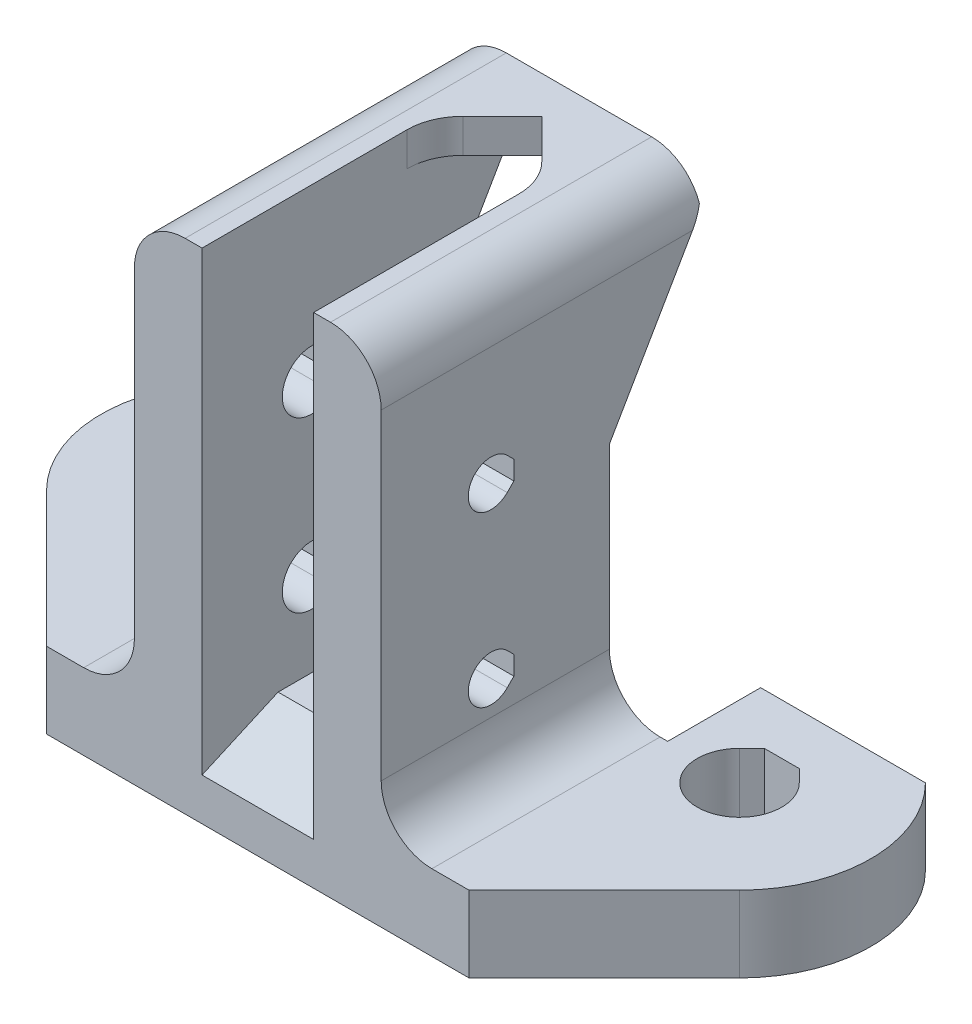
from build123d import *
from OCP.BRepFilletAPI import BRepFilletAPI_MakeChamfer

# Parameters (mm, degrees)
BOSS_EXTRUDE1_DEPTH = 4.5
BOSS_EXTRUDE2_DEPTH = 19
SKETCH4_W           = 6.6
SKETCH4_H           = 4.8
BOSS_EXTRUDE4_DEPTH = 2
SKETCH5_W           = 6.6
SKETCH5_H           = 2
CUT_EXTRUDE1_DEPTH  = 4.5
CUT_EXTRUDE2_REACH  = 45.186
CUT_EXTRUDE4_REACH  = 45.186
SKETCH9_W           = 6.6
SKETCH9_H           = 2
CUT_EXTRUDE5_DEPTH  = 16.8
FILLET3_R           = 3
SKETCH12_W          = 21.495
SKETCH12_H          = 5.5
CUT_EXTRUDE8_DEPTH  = 18
FILLET7_R           = 3
CHAMFER2_SIZE2      = 2
CHAMFER2_SIZE       = 4.5
CHAMFER3_SIZE       = 3.3
FILLET8_R           = 3.3
CHAMFER4_SIZE       = 9.5
CHAMFER4_SIZE_2     = 5.5


with BuildPart() as part:
    # Sketch1 → Boss-Extrude1 (new body)
    with BuildSketch(Plane(origin=(0, 0, 0), x_dir=(1, 0, 0), z_dir=(0, 1, 0))):
        with BuildLine():
            Line((-20.4975, -1.5), (-12.4975, -9.5))
            Line((-12.4975, -9.5), (12.4975, -9.5))
            Line((12.4975, -9.5), (20.4975, -1.5))
            ThreePointArc((20.4975, -1.5), (22.775674593, 4), (20.4975, 9.5))
            Line((20.4975, 9.5), (-20.4975, 9.5))
            ThreePointArc((-20.4975, 9.5), (-22.775674593, 4), (-20.4975, -1.5))
        make_face()
        with BuildLine():
            Line((-16.765266953, 5.767766953), (-16.033033906, 6.5))
            Line((-16.033033906, 6.5), (-13.961966094, 6.5))
            Line((-13.961966094, 6.5), (-13.229733047, 5.767766953))
            ThreePointArc((-13.229733047, 5.767766953), (-13.229733045, 2.232233049), (-16.765266949, 2.232233043))
            ThreePointArc((-16.765266949, 2.232233043), (-17.30719883, 3.043291416), (-17.4975, 4))
            ThreePointArc((-17.4975, 4), (-17.307198831, 4.956708581), (-16.765266953, 5.767766953))
        make_face(mode=Mode.SUBTRACT)
        with BuildLine():
            Line((13.229733047, 5.767766953), (13.961966094, 6.5))
            Line((13.961966094, 6.5), (16.033033906, 6.5))
            Line((16.033033906, 6.5), (16.765266953, 5.767766953))
            ThreePointArc((16.765266953, 5.767766953), (16.765266949, 2.232233043), (13.229733038, 2.232233056))
            ThreePointArc((13.229733038, 2.232233056), (12.4975, 4.000000006), (13.229733047, 5.767766953))
        make_face(mode=Mode.SUBTRACT)
    extrude(amount=BOSS_EXTRUDE1_DEPTH)

    # Sketch2 → Boss-Extrude2 (add, through all)
    with BuildSketch(Plane(origin=(0, 0, -9.5), x_dir=(-1, 0, 0), z_dir=(0, 0, -1))):
        Polygon((-7.3, 4.5), (-3.3, 4.5), (-3.3, 27.5), (3.3, 27.5), (3.3, 4.5), (7.3, 4.5), (7.3, 29.5), (-7.3, 29.5), align=None)
    extrude(amount=-BOSS_EXTRUDE2_DEPTH)

    # Sketch4 → Boss-Extrude4 (add)
    with BuildSketch(Plane(origin=(0, 4.5, 0), x_dir=(1, 0, 0), z_dir=(0, 1, 0))):
        with Locations((0, 7.1)):
            Rectangle(SKETCH4_W, SKETCH4_H)
    extrude(amount=BOSS_EXTRUDE4_DEPTH)

    # Sketch5 → Cut-Extrude1 (cut)
    with BuildSketch(Plane.XY.offset(9.5)):
        with Locations((0, 3.5)):
            Rectangle(SKETCH5_W, SKETCH5_H)
    extrude(amount=-CUT_EXTRUDE1_DEPTH, mode=Mode.SUBTRACT)

    # Sketch6 → Cut-Extrude2 (cut, up to next)
    with BuildSketch(Plane(origin=(7.3, 0, 0), x_dir=(0, 0, -1), z_dir=(1, 0, 0)), mode=Mode.PRIVATE) as cut_extrude2_sk1:
        with BuildLine():
            Line((-1.65, 20.059188309), (-2.045405845, 20.454594155))
            ThreePointArc((-2.045405845, 20.454594155), (-4.35, 19.5), (-2.045405845, 18.545405845))
            Line((-2.045405845, 18.545405845), (-1.65, 18.940811691))
            Line((-1.65, 18.940811691), (-1.65, 20.059188309))
        make_face()
    cut_extrude2_tool1 = extrude(cut_extrude2_sk1.sketch, amount=-CUT_EXTRUDE2_REACH, mode=Mode.PRIVATE) & part.part
    # Sketch6 → Cut-Extrude2 (cut, up to next)
    with BuildSketch(Plane(origin=(7.3, 0, 0), x_dir=(0, 0, -1), z_dir=(1, 0, 0)), mode=Mode.PRIVATE) as cut_extrude2_sk2:
        with BuildLine():
            Line((-1.65, 10.059188309), (-2.045405845, 10.454594155))
            ThreePointArc((-2.045405845, 10.454594155), (-4.35, 9.5), (-2.045405845, 8.545405845))
            Line((-2.045405845, 8.545405845), (-1.65, 8.940811691))
            Line((-1.65, 8.940811691), (-1.65, 10.059188309))
        make_face()
    cut_extrude2_tool2 = extrude(cut_extrude2_sk2.sketch, amount=-CUT_EXTRUDE2_REACH, mode=Mode.PRIVATE) & part.part
    add(cut_extrude2_tool1.solids().sort_by_distance((7.3, 19.5, 2.982857))[0], mode=Mode.SUBTRACT)
    add(cut_extrude2_tool2.solids().sort_by_distance((7.3, 9.5, 2.982857))[0], mode=Mode.SUBTRACT)

    # Sketch8 → Cut-Extrude4 (cut, up to next)
    with BuildSketch(Plane.ZY.offset(7.3), mode=Mode.PRIVATE) as cut_extrude4_sk1:
        with BuildLine():
            Line((1.25, 10.224873734), (1.25, 8.775126266))
            Line((1.25, 8.775126266), (1.762563133, 8.262563133))
            ThreePointArc((1.762563133, 8.262563133), (4.75, 9.5), (1.762563133, 10.737436867))
            Line((1.762563133, 10.737436867), (1.25, 10.224873734))
        make_face()
    cut_extrude4_tool1 = extrude(cut_extrude4_sk1.sketch, amount=-CUT_EXTRUDE4_REACH, mode=Mode.PRIVATE) & part.part
    # Sketch8 → Cut-Extrude4 (cut, up to next)
    with BuildSketch(Plane.ZY.offset(7.3), mode=Mode.PRIVATE) as cut_extrude4_sk2:
        with BuildLine():
            Line((1.25, 20.224873734), (1.25, 18.775126266))
            Line((1.25, 18.775126266), (1.762563133, 18.262563133))
            ThreePointArc((1.762563133, 18.262563133), (4.75, 19.5), (1.762563133, 20.737436867))
            Line((1.762563133, 20.737436867), (1.25, 20.224873734))
        make_face()
    cut_extrude4_tool2 = extrude(cut_extrude4_sk2.sketch, amount=-CUT_EXTRUDE4_REACH, mode=Mode.PRIVATE) & part.part
    add(cut_extrude4_tool1.solids().sort_by_distance((-7.3, 9.5, 2.977778))[0], mode=Mode.SUBTRACT)
    add(cut_extrude4_tool2.solids().sort_by_distance((-7.3, 19.5, 2.977778))[0], mode=Mode.SUBTRACT)

    # Sketch9 → Cut-Extrude5 (cut)
    with BuildSketch(Plane.XY.offset(9.5)):
        with Locations((0, 28.5)):
            Rectangle(SKETCH9_W, SKETCH9_H)
    extrude(amount=-CUT_EXTRUDE5_DEPTH, mode=Mode.SUBTRACT)

    # Fillet3
    fillet3_edges = [part.edges().sort_by_distance(p)[0] for p in [
        (-7.3, 4.5, 0),
        (7.3, 4.5, 0),
    ]]
    fillet(fillet3_edges, radius=FILLET3_R)

    # Sketch12 → Cut-Extrude8 (cut)
    with BuildSketch(Plane.XZ):
        with Locations((0, -6.75)):
            Rectangle(SKETCH12_W, SKETCH12_H)
    extrude(amount=-CUT_EXTRUDE8_DEPTH, mode=Mode.SUBTRACT)

    # Fillet7
    fillet7_edges = [part.edges().sort_by_distance(p)[0] for p in [
        (-7.3, 29.5, 0),
        (7.3, 29.5, 0),
    ]]
    fillet(fillet7_edges, radius=FILLET7_R)

    # Chamfer2
    chamfer2_edges = [part.edges().sort_by_distance(p)[0] for p in [
        (0, 2.5, 5),
    ]]
    chamfer2_side = [part.faces().sort_by_distance(p)[0] for p in [
        (0, 2.5, 5.04),
    ]]
    chamfer(chamfer2_edges, length=CHAMFER2_SIZE - 0.0001, length2=CHAMFER2_SIZE2 - 0.0001, reference=chamfer2_side[0])  # a hair under: the kernel refuses the full size

    # Chamfer3
    chamfer3_edges = [part.edges().sort_by_distance(p)[0] for p in [
        (-3.3, 28.5, -7.3),
        (3.3, 28.5, -7.3),
    ]]
    chamfer(chamfer3_edges, length=CHAMFER3_SIZE - 0.0001)  # a hair under: the kernel refuses the full size

    # Fillet8
    fillet8_edges = [part.edges().sort_by_distance(p)[0] for p in [
        (-3.3, 28.5, -4.0001),
        (3.3, 28.5, -4.0001),
    ]]
    fillet(fillet8_edges, radius=FILLET8_R)

    # Chamfer4
    chamfer4_edges_1 = [part.edges().sort_by_distance(p)[0] for p in [
        (-5.3, 18, -9.5),
    ]]
    chamfer4_side_1 = [part.faces().sort_by_distance(p)[0] for p in [
        (-5.3, 18.11, -9.5),
    ]]
    chamfer4_edges_2 = [part.edges().sort_by_distance(p)[0] for p in [
        (5.3, 18, -9.5),
    ]]
    chamfer4_side_2 = [part.faces().sort_by_distance(p)[0] for p in [
        (5.3, 18, -9.39),
    ]]
    chamfer4 = BRepFilletAPI_MakeChamfer(part.part.solid().wrapped)
    for e in chamfer4_edges_1:
        chamfer4.Add(CHAMFER4_SIZE - 0.0001, CHAMFER4_SIZE_2 - 0.0001, e.wrapped, chamfer4_side_1[0].wrapped)
    for e in chamfer4_edges_2:
        chamfer4.Add(CHAMFER4_SIZE_2 - 0.0001, CHAMFER4_SIZE - 0.0001, e.wrapped, chamfer4_side_2[0].wrapped)
    add(Compound.cast(chamfer4.Shape()), mode=Mode.REPLACE)  # a hair under: the kernel refuses the full size


solid = part.part
